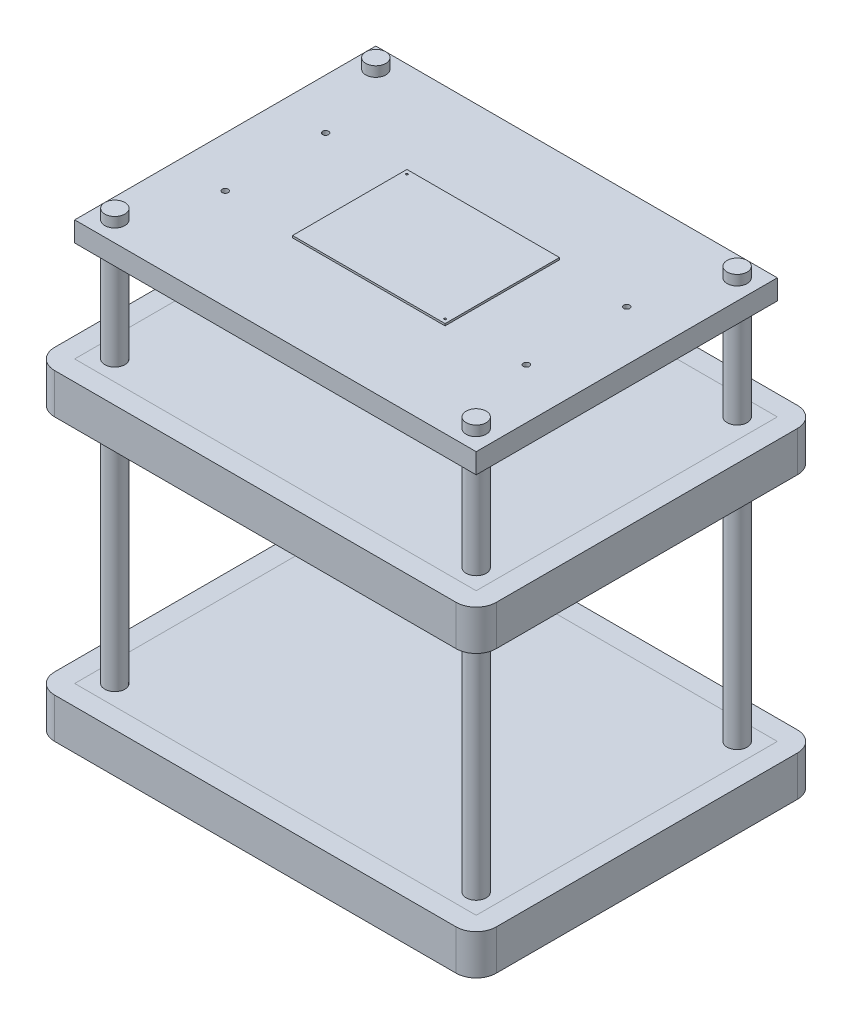
from build123d import *

# Parameters (mm, degrees)
SKETCH1_W            = 200
SKETCH1_H            = 150
BOSS_EXTRUDE1_DEPTH  = 10
SKETCH2_R            = 5
CUT_EXTRUDE1_DEPTH   = 10
SKETCH3_W            = 200
SKETCH3_H            = 150
SKETCH3_R            = 5
BOSS_EXTRUDE2_DEPTH  = 10
SKETCH4_W            = 200
SKETCH4_H            = 150
SKETCH4_R            = 5
BOSS_EXTRUDE3_DEPTH  = 10
BOSS_EXTRUDE13_START = 205
SKETCH21_R           = 5
BOSS_EXTRUDE13_DEPTH = 205
SKETCH22_R           = 5
BOSS_EXTRUDE14_DEPTH = 15
SKETCH23_R           = 1.5
CUT_EXTRUDE2_DEPTH   = 10
SKETCH27_W           = 76
SKETCH27_H           = 57
BOSS_EXTRUDE16_DEPTH = 1
SKETCH30_R           = 0.5
CUT_EXTRUDE3_DEPTH   = 30
SKETCH35_W           = 220
SKETCH35_H           = 170
SKETCH35_W_2         = 200
SKETCH35_H_2         = 150
BOSS_EXTRUDE19_DEPTH = 10
FILLET4_R            = 10
SKETCH39_W           = 220
SKETCH39_H           = 170
SKETCH39_W_2         = 200
SKETCH39_H_2         = 150
BOSS_EXTRUDE20_DEPTH = 10
FILLET5_R            = 10
SKETCH42_W           = 15
SKETCH42_H           = 20
SKETCH42_W_2         = 55
SKETCH42_H_2         = 65
SKETCH42_W_3         = 43.3
SKETCH42_H_3         = 43.3
BOSS_EXTRUDE23_DEPTH = 1


with BuildPart() as part:
    # Sketch1 → Boss-Extrude1 (new body)
    with BuildSketch(Plane(origin=(0, 0, 0), x_dir=(1, 0, 0), z_dir=(0, 1, 0))):
        Rectangle(SKETCH1_W, SKETCH1_H)
    extrude(amount=BOSS_EXTRUDE1_DEPTH)

    # Sketch2 → Cut-Extrude1 (cut)
    with BuildSketch(Plane(origin=(0, 10, 0), x_dir=(1, 0, 0), z_dir=(0, 1, 0))):
        with Locations((-90, 65)):
            Circle(SKETCH2_R)
        with Locations((90, 65)):
            Circle(SKETCH2_R)
        with Locations((90, -65)):
            Circle(SKETCH2_R)
        with Locations((-90, -65)):
            Circle(SKETCH2_R)
    extrude(amount=-CUT_EXTRUDE1_DEPTH, mode=Mode.SUBTRACT)



with BuildPart() as body_2:
    # Sketch3 → Boss-Extrude2 (new body)
    with BuildSketch(Plane(origin=(0, 140, 0), x_dir=(1, 0, 0), z_dir=(0, 1, 0))):
        Rectangle(SKETCH3_W, SKETCH3_H)
        with Locations((-90, 65)):
            Circle(SKETCH3_R, mode=Mode.SUBTRACT)
        with Locations((90, 65)):
            Circle(SKETCH3_R, mode=Mode.SUBTRACT)
        with Locations((-90, -65)):
            Circle(SKETCH3_R, mode=Mode.SUBTRACT)
        with Locations((90, -65)):
            Circle(SKETCH3_R, mode=Mode.SUBTRACT)
    extrude(amount=BOSS_EXTRUDE2_DEPTH)



with BuildPart() as body_3:
    # Sketch4 → Boss-Extrude3 (new body)
    with BuildSketch(Plane(origin=(0, 200, 0), x_dir=(1, 0, 0), z_dir=(0, 1, 0))):
        Rectangle(SKETCH4_W, SKETCH4_H)
        with Locations((-90, 65)):
            Circle(SKETCH4_R, mode=Mode.SUBTRACT)
        with Locations((90, 65)):
            Circle(SKETCH4_R, mode=Mode.SUBTRACT)
        with Locations((90, -65)):
            Circle(SKETCH4_R, mode=Mode.SUBTRACT)
        with Locations((-90, -65)):
            Circle(SKETCH4_R, mode=Mode.SUBTRACT)
    extrude(amount=BOSS_EXTRUDE3_DEPTH)


with BuildPart() as body_2_1:
    add(body_2.part)

    add(body_3.part)  # Boss-Extrude13 merges body 3
    # Sketch21 → Boss-Extrude13 (add)
    with BuildSketch(Plane(origin=(0, 10, 0), x_dir=(1, 0, 0), z_dir=(0, 1, 0)).offset(BOSS_EXTRUDE13_START)):
        with Locations((-90, -65)):
            Circle(SKETCH21_R)
        with Locations((-90, 65)):
            Circle(SKETCH21_R)
        with Locations((90, 65)):
            Circle(SKETCH21_R)
        with Locations((90, -65)):
            Circle(SKETCH21_R)
    extrude(amount=-BOSS_EXTRUDE13_DEPTH)


with BuildPart() as part_1:
    add(part.part)

    add(body_2_1.part)  # Boss-Extrude14 merges body 2
    # Sketch22 → Boss-Extrude14 (add)
    with BuildSketch(Plane(origin=(0, 10, 0), x_dir=(1, 0, 0), z_dir=(0, 1, 0))):
        with Locations((-90, 65)):
            Circle(SKETCH22_R)
        with Locations((-90, -65)):
            Circle(SKETCH22_R)
        with Locations((90, -65)):
            Circle(SKETCH22_R)
        with Locations((90, 65)):
            Circle(SKETCH22_R)
    extrude(amount=-BOSS_EXTRUDE14_DEPTH)

    # Sketch23 → Cut-Extrude2 (cut)
    with BuildSketch(Plane(origin=(0, 210, 0), x_dir=(1, 0, 0), z_dir=(0, 1, 0))):
        with Locations((-75, 25)):
            Circle(SKETCH23_R)
        with Locations((-75, -25)):
            Circle(SKETCH23_R)
        with Locations((75, -25)):
            Circle(SKETCH23_R)
        with Locations((75, 25)):
            Circle(SKETCH23_R)
    extrude(amount=-CUT_EXTRUDE2_DEPTH, mode=Mode.SUBTRACT)

    # Sketch27 → Boss-Extrude16 (add)
    with BuildSketch(Plane(origin=(0, 210, 0), x_dir=(1, 0, 0), z_dir=(0, 1, 0))):
        Rectangle(SKETCH27_W, SKETCH27_H)
    extrude(amount=BOSS_EXTRUDE16_DEPTH)

    # Sketch30 → Cut-Extrude3 (cut)
    with BuildSketch(Plane(origin=(0, 211, 0), x_dir=(1, 0, 0), z_dir=(0, 1, 0))):
        with Locations((-36, 26.5)):
            Circle(SKETCH30_R)
        with Locations((36, -26.5)):
            Circle(SKETCH30_R)
    extrude(amount=-CUT_EXTRUDE3_DEPTH, mode=Mode.SUBTRACT)

    # Sketch42 → Boss-Extrude23 (add)
    with BuildSketch(Plane.XZ.offset(-200)):
        Rectangle(SKETCH42_W, SKETCH42_H)
        with Locations((-43.240305189, 0.303312526)):
            Rectangle(SKETCH42_W_2, SKETCH42_H_2)
        with Locations((37.35, 2.211754737)):
            Rectangle(SKETCH42_W_3, SKETCH42_H_3)
    extrude(amount=BOSS_EXTRUDE23_DEPTH)


with BuildPart() as body_2_2:
    # Sketch35 → Boss-Extrude19 (new, symmetric)
    with BuildSketch(Plane(origin=(0, 0, 0), x_dir=(-1, 0, 0), z_dir=(0, -1, 0))):
        Rectangle(SKETCH35_W, SKETCH35_H)
        Rectangle(SKETCH35_W_2, SKETCH35_H_2, mode=Mode.SUBTRACT)
    extrude(amount=BOSS_EXTRUDE19_DEPTH, both=True)

    # Fillet4
    fillet4_edges = [body_2_2.edges().sort_by_distance(p)[0] for p in [
        (110, 0, 85),
        (110, 0, -85),
        (-110, 0, 85),
        (-110, 0, -85),
    ]]
    fillet(fillet4_edges, radius=FILLET4_R)


with BuildPart() as body_3_2:
    # Sketch39 → Boss-Extrude20 (new, symmetric)
    with BuildSketch(Plane.XZ.offset(-140)):
        Rectangle(SKETCH39_W, SKETCH39_H)
        Rectangle(SKETCH39_W_2, SKETCH39_H_2, mode=Mode.SUBTRACT)
    extrude(amount=BOSS_EXTRUDE20_DEPTH, both=True)

    # Fillet5
    fillet5_edges = [body_3_2.edges().sort_by_distance(p)[0] for p in [
        (110, 140, 85),
        (110, 140, -85),
        (-110, 140, -85),
        (-110, 140, 85),
    ]]
    fillet(fillet5_edges, radius=FILLET5_R)


solid = Compound([part_1.part, body_2_2.part, body_3_2.part])
